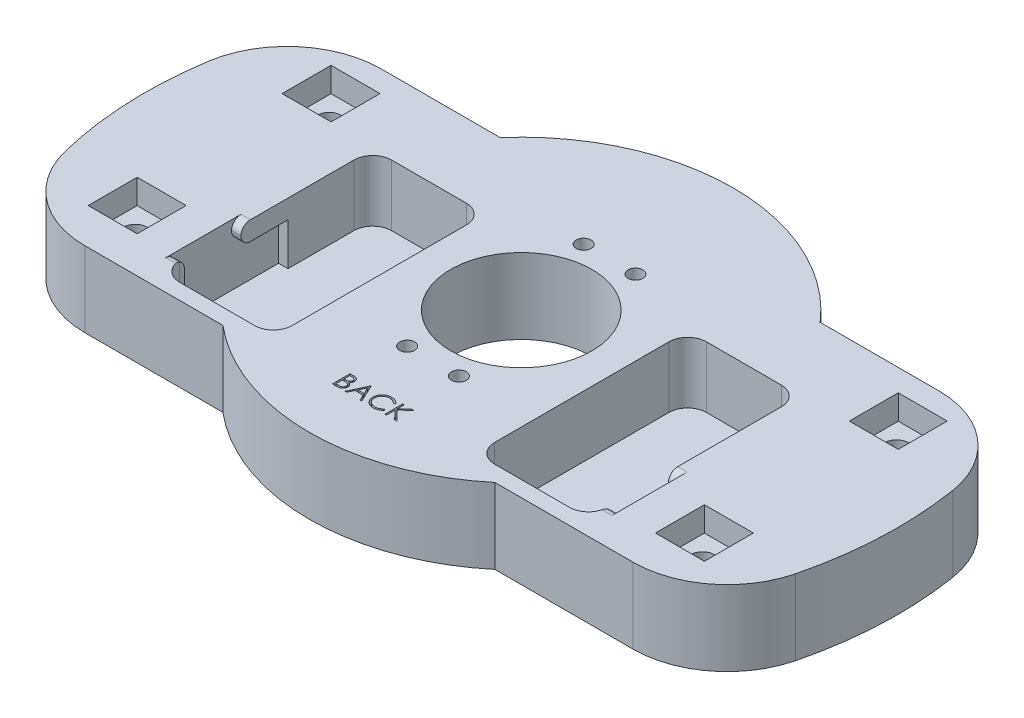
from build123d import *

# Parameters (mm, degrees)
SKETCH1_R                   = 101.6
BOSS_EXTRUDE1_DEPTH         = 10.16
SKETCH2_R                   = 19.05
CUT_EXTRUDE1_DEPTH          = 146.113825668
F_1_4_0_25_DIAMETER_HOLE1_D = 6.35
SKETCH5_W                   = 30.353
SKETCH5_H                   = 57.15
CUT_EXTRUDE2_DEPTH          = 16.51
SKETCH6_W                   = 13.208
SKETCH6_H                   = 13.208
CUT_EXTRUDE3_DEPTH          = 6.6294
CUT_EXTRUDE4_DEPTH          = 146.113825668
FILLET4_R                   = 25.4
FILLET5_R                   = 5.08
CUT_EXTRUDE5_DEPTH          = 2.54
SKETCH9_W                   = 15.24
SKETCH9_H                   = 5.08
CUT_EXTRUDE6_DEPTH          = 2.54
SKETCH10_W                  = 15.24
SKETCH10_H                  = 5.08
CUT_EXTRUDE7_DEPTH          = 2.54
FILLET6_R                   = 2.54
CUT_EXTRUDE8_DEPTH          = 120.893986744
FILLET7_R                   = 25.4
BOSS_EXTRUDE2_DEPTH         = 20.32
SKETCH13_R                  = 2
CUT_EXTRUDE9_DEPTH          = 25.4


with BuildPart() as part:
    # Sketch1 → Boss-Extrude1 (new, symmetric)
    with BuildSketch(Plane(origin=(0, 0, 0), x_dir=(1, 0, 0), z_dir=(0, 1, 0))):
        with Locations(Location((0, 0, 0), (0, 0, 270))):
            Circle(SKETCH1_R)
    extrude(amount=BOSS_EXTRUDE1_DEPTH, both=True)

    # Sketch2 → Cut-Extrude1 (cut, through all)
    with BuildSketch(Plane(origin=(0, 10.16, 0), x_dir=(1, 0, 0), z_dir=(0, 1, 0))):
        with Locations(Location((0, 0, 0), (0, 0, 270))):
            Circle(SKETCH2_R)
    extrude(amount=-CUT_EXTRUDE1_DEPTH, mode=Mode.SUBTRACT)

    # 1/4 (0.25) Diameter Hole1 (through all)
    with Locations(Plane(origin=(0, 10.16, 0), x_dir=(1, 0, 0), z_dir=(0, 1, 0))):
        with Locations((-76.5048, 24.6761), (-76.5048, -27.6225), (76.5048, 24.6761), (76.5048, -27.6225)):
            Hole(F_1_4_0_25_DIAMETER_HOLE1_D / 2)

    # Sketch5 → Cut-Extrude2 (cut)
    with BuildSketch(Plane(origin=(0, 10.16, 0), x_dir=(1, 0, 0), z_dir=(0, 1, 0))):
        with Locations((-42.4815, -10.9982)):
            Rectangle(SKETCH5_W, SKETCH5_H)
        with Locations((42.4815, -10.9982)):
            Rectangle(SKETCH5_W, SKETCH5_H)
    extrude(amount=-CUT_EXTRUDE2_DEPTH, mode=Mode.SUBTRACT)

    # Sketch6 → Cut-Extrude3 (cut)
    with BuildSketch(Plane(origin=(0, 10.16, 0), x_dir=(1, 0, 0), z_dir=(0, 1, 0))):
        with Locations((-76.2508, 24.9301)):
            Rectangle(SKETCH6_W, SKETCH6_H)
        with Locations((-76.2508, -27.3685)):
            Rectangle(SKETCH6_W, SKETCH6_H)
        with Locations((76.7588, 24.9301)):
            Rectangle(SKETCH6_W, SKETCH6_H)
        with Locations((76.7588, -27.3685)):
            Rectangle(SKETCH6_W, SKETCH6_H)
    extrude(amount=-CUT_EXTRUDE3_DEPTH, mode=Mode.SUBTRACT)

    # Sketch7 → Cut-Extrude4 (cut, through all)
    with BuildSketch(Plane(origin=(0, 10.16, 0), x_dir=(1, 0, 0), z_dir=(0, 1, 0))):
        with BuildLine():
            ThreePointArc((81.752396754, 60.325), (0, 101.6), (-81.752396754, 60.325))
            Line((-81.752396754, 60.325), (81.752396754, 60.325))
        make_face()
        with BuildLine():
            Line((81.752396754, -60.325), (-81.752396754, -60.325))
            ThreePointArc((-81.752396754, -60.325), (0, -101.6), (81.752396754, -60.325))
        make_face()
    extrude(amount=-CUT_EXTRUDE4_DEPTH, mode=Mode.SUBTRACT)

    # Fillet4
    fillet4_edges = [part.edges().sort_by_distance(p)[0] for p in [
        (-81.752396754, 0, -60.325),
        (81.752396754, 0, -60.325),
        (-81.752396754, 0, 60.325),
        (81.752396754, 0, 60.325),
    ]]
    fillet(fillet4_edges, radius=FILLET4_R)

    # Fillet5
    fillet5_edges = [part.edges().sort_by_distance(p)[0] for p in [
        (-57.658, 1.905, 39.5732),
        (-57.658, 1.905, -17.5768),
        (-27.305, 1.905, -17.5768),
        (-27.305, 1.905, 39.5732),
        (27.305, 1.905, 39.5732),
        (27.305, 1.905, -17.5768),
        (57.658, 1.905, -17.5768),
        (57.658, 1.905, 39.5732),
    ]]
    fillet(fillet5_edges, radius=FILLET5_R)

    # Sketch8 → Cut-Extrude5 (cut)
    # profile 1 of 4: a face of its own
    with BuildSketch(Plane(origin=(0, 10.16, 0), x_dir=(1, 0, 0), z_dir=(0, 1, 0))):
        with BuildLine():
            Line((-8.248369289, -37.952213826), (-7.319147534, -37.952213826))
            add(Edge.make_bspline(
                [(-7.319147534, -37.952213826), (-7.273660926, -37.952452972), (-7.18549656, -37.952916497), (-7.057290819, -37.960105329), (-6.937209402, -37.969907466), (-6.825217483, -37.985460556), (-6.721366813, -38.004227224), (-6.625344421, -38.026953624), (-6.537455651, -38.054204123), (-6.432527249, -38.097537813), (-6.312892349, -38.161931124), (-6.183354537, -38.257083922), (-6.072586625, -38.373469166), (-5.977083101, -38.504754494), (-5.90115372, -38.649174955), (-5.84622264, -38.803288351), (-5.811445674, -38.965106864), (-5.807869126, -39.076199902), (-5.806061597, -39.132344535)],
                knots=[0, 0, 0, 0, 1.001505555, 1.941167018, 2.826882275, 3.653841531, 4.429895133, 5.150066043, 5.825578002, 6.45369114, 7.647487171, 8.808567382, 9.977351308, 11.170798116, 12.373658725, 13.556498008, 14.765093433, 16, 16, 16, 16], degree=3))
            add(Edge.make_bspline(
                [(-5.806061597, -39.132344535), (-5.807549154, -39.18493962), (-5.810472346, -39.288293922), (-5.838425172, -39.439461263), (-5.882186653, -39.583358457), (-5.943017724, -39.719460346), (-6.022077941, -39.844691798), (-6.115774439, -39.960063042), (-6.228818231, -40.060689302), (-6.313513496, -40.11694518), (-6.356534854, -40.145520617)],
                knots=[0, 0, 0, 0, 1.044552857, 2.05264487, 3.044412934, 4.028983338, 5.005914585, 5.980388656, 6.974128949, 8, 8, 8, 8], degree=3))
            add(Edge.make_bspline(
                [(-6.356534854, -40.145520617), (-6.302432272, -40.166291919), (-6.198920631, -40.206032566), (-6.056472878, -40.276293679), (-5.933743464, -40.352714265), (-5.829788776, -40.43616939), (-5.740882896, -40.526124593), (-5.663250143, -40.623898874), (-5.597008702, -40.730767683), (-5.540249331, -40.84561678), (-5.495959773, -40.967273438), (-5.462791132, -41.09459653), (-5.443785424, -41.227129496), (-5.441080813, -41.317324959), (-5.439715443, -41.362858358)],
                knots=[0, 0, 0, 0, 1.27268992, 2.434971085, 3.483601985, 4.442670788, 5.356604649, 6.2567628, 7.179492994, 8.113709626, 9.066344395, 10.018646069, 10.999752585, 12, 12, 12, 12], degree=3))
            add(Edge.make_bspline(
                [(-5.439715443, -41.362858358), (-5.441044651, -41.409349709), (-5.443659906, -41.500822744), (-5.462954796, -41.635200267), (-5.495624331, -41.763617605), (-5.540624712, -41.886905371), (-5.59935629, -42.004825054), (-5.670831842, -42.117510245), (-5.756055505, -42.223828745), (-5.851391052, -42.324961961), (-5.959244185, -42.415895486), (-6.075606695, -42.496879358), (-6.201944009, -42.563480964), (-6.336181186, -42.619428122), (-6.479824059, -42.662164346), (-6.632227607, -42.692062741), (-6.793260389, -42.712208166), (-6.903763658, -42.713864434), (-6.960433592, -42.714713826)],
                knots=[0, 0, 0, 0, 0.978564426, 1.925352924, 2.850884081, 3.763762016, 4.682927383, 5.618979971, 6.567305752, 7.547517671, 8.540179244, 9.531824382, 10.526200242, 11.540722885, 12.589160233, 13.674978461, 14.80764778, 16, 16, 16, 16], degree=3))
            Line((-6.960433592, -42.714713826), (-8.248369289, -42.714713826))
            Line((-8.248369289, -42.714713826), (-8.248369289, -37.952213826))
        make_face()
        with BuildLine():
            Line((-7.820965443, -38.440675365), (-7.820965443, -39.967117673))
            Line((-7.820965443, -39.967117673), (-7.533803484, -39.967117673))
            add(Edge.make_bspline(
                [(-7.533803484, -39.967117673), (-7.491827087, -39.966573492), (-7.410720135, -39.965522023), (-7.293263418, -39.962510059), (-7.184236161, -39.954076293), (-7.08382656, -39.94564495), (-6.992192734, -39.931936315), (-6.909537694, -39.915618462), (-6.834564246, -39.898360652), (-6.748105079, -39.869010743), (-6.650034388, -39.825634335), (-6.545486486, -39.758317301), (-6.453319225, -39.678138091), (-6.375490195, -39.585621819), (-6.311793158, -39.48375033), (-6.267551282, -39.374149039), (-6.237551227, -39.259549502), (-6.234841322, -39.18087538), (-6.233465443, -39.140930773)],
                knots=[0, 0, 0, 0, 1.156816544, 2.235205308, 3.236616184, 4.169592532, 5.011045266, 5.787822928, 6.49130361, 7.128639758, 8.301311294, 9.436451833, 10.541879658, 11.654887649, 12.756523258, 13.837046038, 14.901820046, 16, 16, 16, 16], degree=3))
            add(Edge.make_bspline(
                [(-6.233465443, -39.140930773), (-6.234181424, -39.114497849), (-6.235585898, -39.06264678), (-6.247088428, -38.98705998), (-6.266638592, -38.91597116), (-6.291749612, -38.848406103), (-6.326840649, -38.786477478), (-6.368156648, -38.728044058), (-6.41807539, -38.675095783), (-6.474895162, -38.625607287), (-6.540221181, -38.581731697), (-6.614014475, -38.543304087), (-6.697273421, -38.512360388), (-6.788594842, -38.485260194), (-6.889384428, -38.466226123), (-6.998479089, -38.450369192), (-7.116772403, -38.442296425), (-7.198612703, -38.441227771), (-7.240917366, -38.440675365)],
                knots=[0, 0, 0, 0, 0.91205012, 1.789085906, 2.630437955, 3.453916878, 4.269457761, 5.079663411, 5.91843418, 6.774407191, 7.675494373, 8.627863946, 9.638891023, 10.736472738, 11.911756761, 13.175263542, 14.539845004, 16, 16, 16, 16], degree=3))
            Line((-7.240917366, -38.440675365), (-7.820965443, -38.440675365))
        make_face(mode=Mode.SUBTRACT)
        with BuildLine():
            Line((-7.820965443, -40.455579211), (-7.820965443, -42.226252288))
            Line((-7.820965443, -42.226252288), (-7.212296572, -42.226252288))
            add(Edge.make_bspline(
                [(-7.212296572, -42.226252288), (-7.168727963, -42.225730117), (-7.084755211, -42.224723702), (-6.963513894, -42.221438184), (-6.851141885, -42.213964766), (-6.748151957, -42.202200234), (-6.65343202, -42.189438845), (-6.56811836, -42.172278494), (-6.491519407, -42.152617587), (-6.402699724, -42.12222716), (-6.302682451, -42.075015177), (-6.194899107, -42.003830461), (-6.099069146, -41.919026246), (-6.017691275, -41.820876681), (-5.950998601, -41.714154054), (-5.902481714, -41.601016988), (-5.872558441, -41.483334896), (-5.86893599, -41.403098048), (-5.867119289, -41.362858358)],
                knots=[0, 0, 0, 0, 1.160039823, 2.235823828, 3.228722157, 4.157150951, 4.99529583, 5.772374946, 6.472645482, 7.099169577, 8.269452708, 9.405989375, 10.527446681, 11.663510218, 12.788923519, 13.866172445, 14.929861265, 16, 16, 16, 16], degree=3))
            add(Edge.make_bspline(
                [(-5.867119289, -41.362858358), (-5.867494988, -41.337694205), (-5.868240326, -41.2877718), (-5.879480663, -41.214407774), (-5.895828107, -41.143343282), (-5.916961951, -41.074385357), (-5.947740583, -41.008780727), (-5.983672346, -40.945231887), (-6.025801968, -40.883654831), (-6.091448493, -40.805805301), (-6.186932515, -40.716111079), (-6.322604949, -40.628293978), (-6.476872254, -40.557471784), (-6.588760379, -40.52740071), (-6.646558892, -40.511866771)],
                knots=[0, 0, 0, 0, 0.723448775, 1.435228256, 2.130040452, 2.821711965, 3.505591119, 4.210454504, 4.921174351, 5.648778258, 7.137944449, 8.670945889, 10.280296675, 12, 12, 12, 12], degree=3))
            add(Edge.make_bspline(
                [(-6.646558892, -40.511866771), (-6.669730626, -40.507165389), (-6.719971725, -40.496971823), (-6.80189704, -40.486211698), (-6.895426919, -40.476625384), (-7.000777334, -40.469534488), (-7.118081575, -40.462204941), (-7.247590168, -40.459354488), (-7.388774228, -40.455953709), (-7.486735277, -40.455707237), (-7.537619589, -40.455579211)],
                knots=[0, 0, 0, 0, 0.634451884, 1.375622551, 2.216452059, 3.157844607, 4.20941857, 5.370758133, 6.634282058, 8, 8, 8, 8], degree=3))
            Line((-7.537619589, -40.455579211), (-7.820965443, -40.455579211))
        make_face(mode=Mode.SUBTRACT)
    # profile 2 of 4: a face of its own
    with BuildSketch(Plane(origin=(0, 10.16, 0), x_dir=(1, 0, 0), z_dir=(0, 1, 0))):
        Polygon((-2.508946212, -37.952213826), (-0.310869289, -42.714713826), (-0.775480166, -42.714713826), (-1.479551681, -41.188271519), (-3.63851352, -41.188271519), (-4.362619589, -42.714713826), (-4.82913852, -42.714713826), (-2.570003904, -37.952213826), align=None)
        Polygon((-2.54424519, -38.880481555), (-3.406685094, -40.69980998), (-1.704701921, -40.69980998), align=None, mode=Mode.SUBTRACT)
    # profile 3 of 4: a face of its own
    with BuildSketch(Plane(origin=(0, 10.16, 0), x_dir=(1, 0, 0), z_dir=(0, 1, 0))):
        with BuildLine():
            Line((4.94009225, -38.826102048), (4.566113884, -39.11230998))
            add(Edge.make_bspline(
                [(4.566113884, -39.11230998), (4.539435872, -39.080515571), (4.486439525, -39.017355411), (4.401178253, -38.928664674), (4.312321374, -38.8455723), (4.219902856, -38.767682457), (4.122259197, -38.697718929), (4.021755753, -38.63203575), (3.91671127, -38.573160721), (3.771452659, -38.501773586), (3.581431837, -38.427279711), (3.342225288, -38.364818528), (3.092519115, -38.325056857), (2.922160953, -38.320750412), (2.835509918, -38.31855998)],
                knots=[0, 0, 0, 0, 0.757959112, 1.505699292, 2.245454638, 2.979532153, 3.711538275, 4.438200793, 5.171680507, 5.909471876, 7.393775596, 8.890124382, 10.418191784, 12, 12, 12, 12], degree=3))
            add(Edge.make_bspline(
                [(2.835509918, -38.31855998), (2.787771571, -38.319109658), (2.692737935, -38.320203911), (2.551701976, -38.3346399), (2.413299575, -38.354929796), (2.277620758, -38.385036039), (2.144838232, -38.423098782), (2.014083928, -38.46858122), (1.887250933, -38.524853341), (1.762584688, -38.587049224), (1.643142261, -38.657299425), (1.530128071, -38.733925808), (1.423954301, -38.8160709), (1.324536961, -38.904042584), (1.231774417, -38.99744468), (1.146338826, -39.097272588), (1.068525821, -39.203207152), (0.996793012, -39.313851468), (0.932549971, -39.428883248), (0.8787611, -39.548728255), (0.83112913, -39.671334195), (0.793438375, -39.79808631), (0.763605372, -39.928092717), (0.743020944, -40.061702325), (0.728749131, -40.19863601), (0.727660319, -40.291449396), (0.72711148, -40.338233959)],
                knots=[0, 0, 0, 0, 1.054917814, 2.100044995, 3.131103042, 4.146048494, 5.169673617, 6.183595914, 7.203665975, 8.234915748, 9.262203917, 10.264457458, 11.251630812, 12.227803204, 13.197192746, 14.159520551, 15.12972552, 16.100847026, 17.073214652, 18.039054194, 19.002613845, 19.979014051, 20.95965708, 21.949030935, 22.966165397, 24, 24, 24, 24], degree=3))
            add(Edge.make_bspline(
                [(0.72711148, -40.338233959), (0.728828456, -40.408625505), (0.732199509, -40.546829968), (0.762200992, -40.749264263), (0.807791848, -40.94319418), (0.876120901, -41.127407466), (0.960375038, -41.304175624), (1.066838155, -41.470507778), (1.190141372, -41.628917461), (1.332029065, -41.7756609), (1.487702693, -41.909709934), (1.65472753, -42.027752689), (1.832687578, -42.126152583), (2.019617922, -42.208034853), (2.216957027, -42.270977043), (2.424350026, -42.315287511), (2.641345848, -42.34419205), (2.789622067, -42.346959318), (2.865084738, -42.348367673)],
                knots=[0, 0, 0, 0, 1.029171465, 2.020641659, 2.987623507, 3.938342917, 4.889210282, 5.84687017, 6.821220943, 7.821438502, 8.827599549, 9.822697543, 10.807740252, 11.797342354, 12.80366471, 13.83203677, 14.896651826, 16, 16, 16, 16], degree=3))
            add(Edge.make_bspline(
                [(2.865084738, -42.348367673), (2.948228039, -42.346069726), (3.111873947, -42.341546817), (3.35186044, -42.303230124), (3.581597678, -42.241102743), (3.801098019, -42.154155928), (4.009742663, -42.041127804), (4.207858118, -41.904106763), (4.395611612, -41.741789425), (4.508511822, -41.617851311), (4.566113884, -41.554617673)],
                knots=[0, 0, 0, 0, 1.028121516, 2.023589091, 2.998037872, 3.967518031, 4.937445131, 5.927275754, 6.942489185, 8, 8, 8, 8], degree=3))
            Line((4.566113884, -41.554617673), (4.94009225, -41.837963526))
            add(Edge.make_bspline(
                [(4.94009225, -41.837963526), (4.909995822, -41.876796205), (4.849947126, -41.954275557), (4.752713181, -42.063502419), (4.650282287, -42.166241839), (4.541893625, -42.261665495), (4.428794058, -42.351682822), (4.308952805, -42.433736385), (4.1839453, -42.508971481), (4.054195098, -42.57786026), (3.919840057, -42.6389798), (3.781041165, -42.691304391), (3.638396703, -42.736377902), (3.491900151, -42.773460001), (3.341247639, -42.802403869), (3.186982815, -42.821752784), (3.028772735, -42.835008746), (2.922036373, -42.836216946), (2.867946817, -42.836829211)],
                knots=[0, 0, 0, 0, 0.986787822, 1.968848986, 2.935600012, 3.899624008, 4.868462664, 5.837806735, 6.815139263, 7.798259679, 8.787526145, 9.778297419, 10.776456485, 11.791383307, 12.812564526, 13.85620153, 14.913611965, 16, 16, 16, 16], degree=3))
            add(Edge.make_bspline(
                [(2.867946817, -42.836829211), (2.816724541, -42.836472714), (2.715438835, -42.835767785), (2.565898033, -42.824348443), (2.420315782, -42.808768623), (2.279108166, -42.78530973), (2.141504607, -42.757626896), (2.008752526, -42.720518507), (1.879545615, -42.67894982), (1.75440298, -42.630093392), (1.633218174, -42.574962443), (1.51638206, -42.512653215), (1.403948371, -42.443689678), (1.294811709, -42.369591967), (1.190584283, -42.287979995), (1.090362879, -42.199987182), (0.993585509, -42.105910103), (0.933710427, -42.038071892), (0.903606372, -42.003964127)],
                knots=[0, 0, 0, 0, 1.114604814, 2.203992996, 3.262667896, 4.300477797, 5.318619304, 6.316056647, 7.298880507, 8.271930387, 9.238335007, 10.195173496, 11.151986948, 12.108099108, 13.064862484, 14.031167946, 15.010108607, 16, 16, 16, 16], degree=3))
            add(Edge.make_bspline(
                [(0.903606372, -42.003964127), (0.855388586, -41.944717009), (0.759535141, -41.826938057), (0.636899836, -41.636048918), (0.531924055, -41.436747534), (0.447048249, -41.227986845), (0.380696101, -41.010235293), (0.334729546, -40.783383111), (0.304859684, -40.547642161), (0.301443899, -40.387299959), (0.299707634, -40.30579706)],
                knots=[0, 0, 0, 0, 0.994628077, 1.977248131, 2.950237994, 3.925870899, 4.908910175, 5.911660606, 6.938484602, 8, 8, 8, 8], degree=3))
            add(Edge.make_bspline(
                [(0.299707634, -40.30579706), (0.301823808, -40.220132675), (0.305987249, -40.051593345), (0.341360099, -39.80425093), (0.398263532, -39.567280634), (0.479085727, -39.341124824), (0.581554795, -39.124593979), (0.708137437, -38.919342196), (0.857363084, -38.724056837), (1.028061381, -38.54170105), (1.21525122, -38.374960002), (1.415710035, -38.228266561), (1.629045469, -38.106186655), (1.852907261, -38.004138306), (2.088971706, -37.925700661), (2.336735147, -37.870791504), (2.595732028, -37.836614285), (2.772437686, -37.832293734), (2.862222658, -37.830098442)],
                knots=[0, 0, 0, 0, 1.032925535, 2.032216505, 3.007276963, 3.968222605, 4.92396291, 5.891752235, 6.871517503, 7.883894988, 8.900124299, 9.891468569, 10.874487609, 11.85992873, 12.854644235, 13.869047385, 14.917252991, 16, 16, 16, 16], degree=3))
            add(Edge.make_bspline(
                [(2.862222658, -37.830098442), (2.916943065, -37.830754494), (3.025256599, -37.832053084), (3.185484315, -37.844716084), (3.341479767, -37.86582567), (3.493350425, -37.894558608), (3.641835127, -37.930219284), (3.785799027, -37.976674476), (3.926086883, -38.029792042), (4.061813926, -38.090967669), (4.192328946, -38.159638485), (4.317591293, -38.235043315), (4.436605976, -38.317088679), (4.550210445, -38.405076786), (4.656504289, -38.500869111), (4.758505444, -38.60183084), (4.852749982, -38.710870079), (4.910924865, -38.787621078), (4.94009225, -38.826102048)],
                knots=[0, 0, 0, 0, 1.096760587, 2.17092713, 3.219439832, 4.250915756, 5.268269357, 6.278326846, 7.281116186, 8.274029601, 9.260640565, 10.235837813, 11.203064059, 12.156899882, 13.114053108, 14.069676657, 15.032185724, 16, 16, 16, 16], degree=3))
        make_face()
    # profile 4 of 4: a face of its own
    with BuildSketch(Plane(origin=(0, 10.16, 0), x_dir=(1, 0, 0), z_dir=(0, 1, 0))):
        Polygon((5.917015327, -37.952213826), (6.344419173, -37.952213826), (6.344419173, -39.765818093), (8.329748199, -37.952213826), (8.939371096, -37.952213826), (6.599144233, -40.089233057), (9.122544173, -42.714713826), (8.552990387, -42.714713826), (6.344419173, -40.416464127), (6.344419173, -42.714713826), (5.917015327, -42.714713826), align=None)
    extrude(amount=-CUT_EXTRUDE5_DEPTH, mode=Mode.SUBTRACT)

    # Sketch9 → Cut-Extrude6 (cut)
    with BuildSketch(Plane.ZY.offset(-57.658)):
        Polygon((17.9832, 5.08), (5.2832, 5.08), (5.2832, -6.35), (33.2232, -6.35), (33.2232, 5.08), align=None)
        with Locations((25.6032, 7.62)):
            Rectangle(SKETCH9_W, SKETCH9_H)
    extrude(amount=-CUT_EXTRUDE6_DEPTH, mode=Mode.SUBTRACT)

    # Sketch10 → Cut-Extrude7 (cut)
    with BuildSketch(Plane(origin=(-57.658, 0, 0), x_dir=(0, 0, -1), z_dir=(1, 0, 0))):
        Polygon((-33.2232, -6.35), (-5.2832, -6.35), (-5.2832, 5.08), (-17.9832, 5.08), (-33.2232, 5.08), align=None)
        with Locations((-25.6032, 7.62)):
            Rectangle(SKETCH10_W, SKETCH10_H)
    extrude(amount=-CUT_EXTRUDE7_DEPTH, mode=Mode.SUBTRACT)

    # Fillet6
    fillet6_edges = [part.edges().sort_by_distance(p)[0] for p in [
        (58.928, 10.16, 17.9832),
        (58.928, 10.16, 33.2232),
        (-58.928, 10.16, 33.2232),
        (-58.928, 10.16, 17.9832),
        (-58.928, 5.08, 17.9832),
        (58.928, 5.08, 17.9832),
    ]]
    fillet(fillet6_edges, radius=FILLET6_R - 0.0001)  # a hair under: the kernel refuses the full size

    # Sketch11 → Cut-Extrude8 (cut, through all)
    with BuildSketch(Plane(origin=(0, 10.16, 0), x_dir=(1, 0, 0), z_dir=(0, 1, 0))):
        with BuildLine():
            ThreePointArc((-90.300086133, 46.566666667), (-92.482132363, 42.066794429), (-94.440106814, 37.465))
            Line((-94.440106814, 37.465), (94.440106814, 37.465))
            ThreePointArc((94.440106814, 37.465), (92.482132363, 42.066794429), (90.300086133, 46.566666667))
            ThreePointArc((90.300086133, 46.566666667), (80.943643696, 56.614379121), (67.725064599, 60.325))
            Line((67.725064599, 60.325), (-67.725064599, 60.325))
            ThreePointArc((-67.725064599, 60.325), (-80.943643696, 56.614379121), (-90.300086133, 46.566666667))
        make_face()
        with BuildLine():
            Line((91.666819379, -43.815), (-91.666819379, -43.815))
            ThreePointArc((-91.666819379, -43.815), (-90.993854697, -45.195999904), (-90.300086133, -46.566666667))
            ThreePointArc((-90.300086133, -46.566666667), (-80.943643696, -56.614379121), (-67.725064599, -60.325))
            Line((-67.725064599, -60.325), (67.725064599, -60.325))
            ThreePointArc((67.725064599, -60.325), (80.943643696, -56.614379121), (90.300086133, -46.566666667))
            ThreePointArc((90.300086133, -46.566666667), (90.993854697, -45.195999904), (91.666819379, -43.815))
        make_face()
    extrude(amount=-CUT_EXTRUDE8_DEPTH, mode=Mode.SUBTRACT)

    # Fillet7
    fillet7_edges = [part.edges().sort_by_distance(p)[0] for p in [
        (94.440106814, 0, -37.465),
        (-94.440106814, 0, -37.465),
        (-91.666819379, 0, 43.815),
        (91.666819379, 0, 43.815),
    ]]
    fillet(fillet7_edges, radius=FILLET7_R)

    # Sketch12 → Boss-Extrude2 (add)
    with BuildSketch(Plane(origin=(0, 10.16, 0), x_dir=(1, 0, 0), z_dir=(0, 1, 0))):
        with BuildLine():
            ThreePointArc((43.156648097, 37.465), (0, 57.15), (-43.156648097, 37.465))
            Line((-43.156648097, 37.465), (43.156648097, 37.465))
        make_face()
        with BuildLine():
            Line((36.692891342, -43.815), (-36.692891342, -43.815))
            ThreePointArc((-36.692891342, -43.815), (0, -57.15), (36.692891342, -43.815))
        make_face()
    extrude(amount=-BOSS_EXTRUDE2_DEPTH)

    # Sketch13 → Cut-Extrude9 (cut)
    with BuildSketch(Plane(origin=(0, 10.16, 0), x_dir=(1, 0, 0), z_dir=(0, 1, 0))):
        with Locations(Location((-6.985, 23.8125, 0), (0, 0, 270))):
            Circle(SKETCH13_R)
        with Locations(Location((6.985, 23.8125, 0), (0, 0, 270))):
            Circle(SKETCH13_R)
        with Locations(Location((-6.985, -23.8125, 0), (0, 0, 270))):
            Circle(SKETCH13_R)
        with Locations(Location((6.985, -23.8125, 0), (0, 0, 270))):
            Circle(SKETCH13_R)
    extrude(amount=-CUT_EXTRUDE9_DEPTH, mode=Mode.SUBTRACT)


solid = part.part
